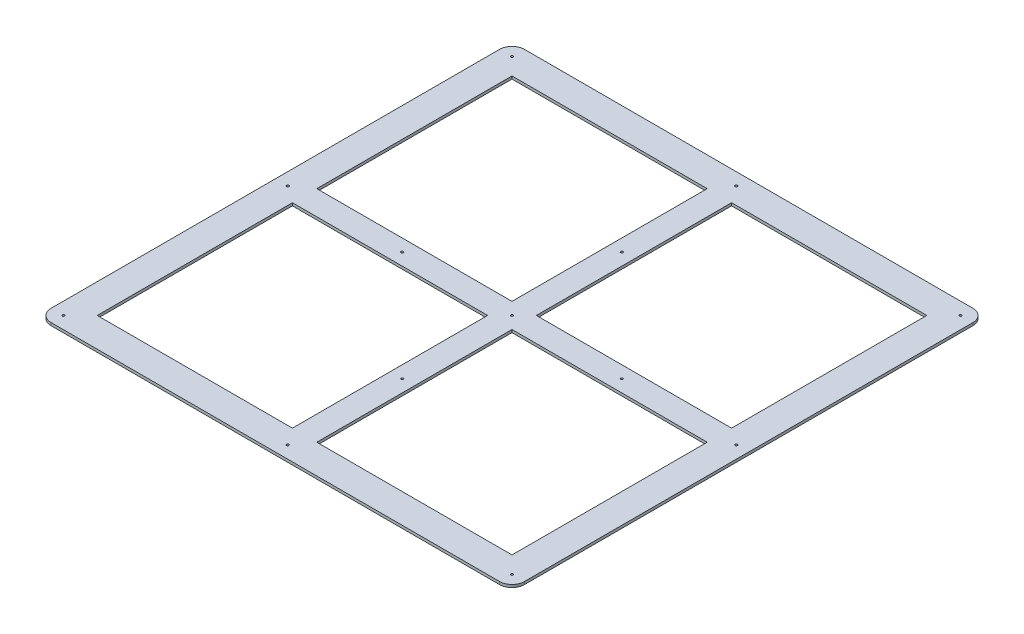
from build123d import *

# Parameters (mm, degrees)
SKETCH1_R           = 1.1684
SKETCH1_W           = 200.1774
SKETCH1_H           = 200.1774
BOSS_EXTRUDE1_DEPTH = 2.794


with BuildPart() as part:
    # Sketch1 → Boss-Extrude1 (new body)
    with BuildSketch(Plane(origin=(0, 0, 0), x_dir=(1, 0, 0), z_dir=(0, 1, 0))):
        with BuildLine():
            Line((-229.9774, 242.6774), (229.9774, 242.6774))
            ThreePointArc((229.9774, 242.6774), (238.957656121, 238.957656121), (242.6774, 229.9774))
            Line((242.6774, 229.9774), (242.6774, -229.9774))
            ThreePointArc((242.6774, -229.9774), (238.957656121, -238.957656121), (229.9774, -242.6774))
            Line((229.9774, -242.6774), (-229.9774, -242.6774))
            ThreePointArc((-229.9774, -242.6774), (-238.957656121, -238.957656121), (-242.6774, -229.9774))
            Line((-242.6774, -229.9774), (-242.6774, 229.9774))
            ThreePointArc((-242.6774, 229.9774), (-238.957656121, 238.957656121), (-229.9774, 242.6774))
        make_face()
        with Locations((-229.9774, 229.9774)):
            Circle(SKETCH1_R, mode=Mode.SUBTRACT)
        with Locations((229.9774, 229.9774)):
            Circle(SKETCH1_R, mode=Mode.SUBTRACT)
        with Locations((229.9774, -229.9774)):
            Circle(SKETCH1_R, mode=Mode.SUBTRACT)
        with Locations((-229.9774, -229.9774)):
            Circle(SKETCH1_R, mode=Mode.SUBTRACT)
        Circle(SKETCH1_R, mode=Mode.SUBTRACT)
        with Locations((-112.5887, 0)):
            Circle(SKETCH1_R, mode=Mode.SUBTRACT)
        with Locations((0, -112.5887)):
            Circle(SKETCH1_R, mode=Mode.SUBTRACT)
        with Locations((112.5887, 0)):
            Circle(SKETCH1_R, mode=Mode.SUBTRACT)
        with Locations((0, 112.5887)):
            Circle(SKETCH1_R, mode=Mode.SUBTRACT)
        with Locations((-229.9774, 0)):
            Circle(SKETCH1_R, mode=Mode.SUBTRACT)
        with Locations((0, -229.9774)):
            Circle(SKETCH1_R, mode=Mode.SUBTRACT)
        with Locations((229.9774, 0)):
            Circle(SKETCH1_R, mode=Mode.SUBTRACT)
        with Locations((0, 229.9774)):
            Circle(SKETCH1_R, mode=Mode.SUBTRACT)
        with Locations((-112.5887, 112.5887)):
            Rectangle(SKETCH1_W, SKETCH1_H, mode=Mode.SUBTRACT)
        with Locations((112.5887, 112.5887)):
            Rectangle(SKETCH1_W, SKETCH1_H, mode=Mode.SUBTRACT)
        with Locations((112.5887, -112.5887)):
            Rectangle(SKETCH1_W, SKETCH1_H, mode=Mode.SUBTRACT)
        with Locations((-112.5887, -112.5887)):
            Rectangle(SKETCH1_W, SKETCH1_H, mode=Mode.SUBTRACT)
    extrude(amount=BOSS_EXTRUDE1_DEPTH)


solid = part.part
